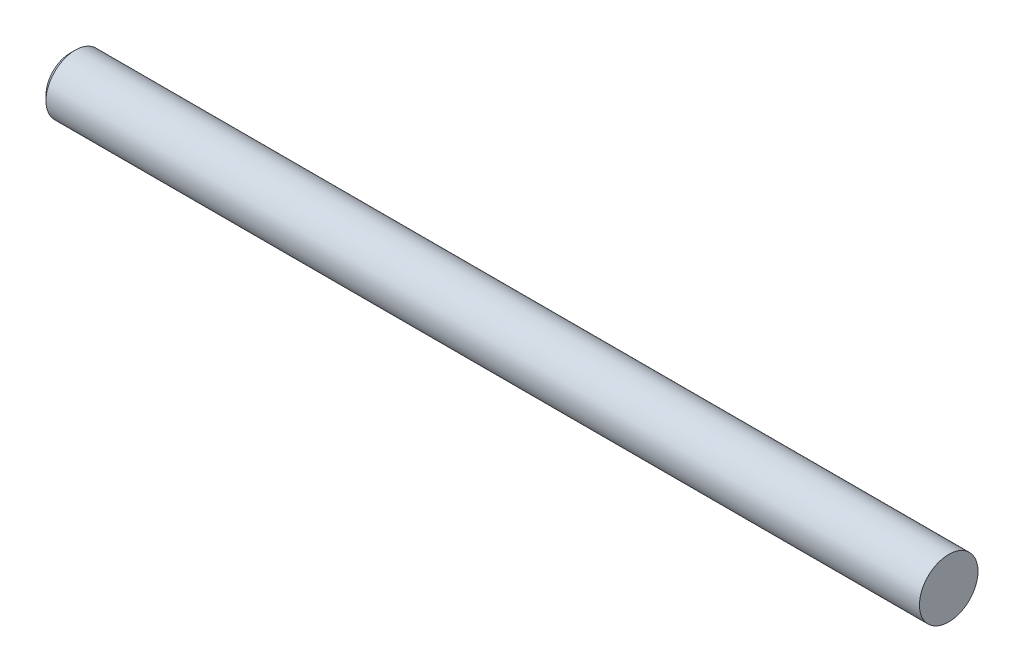
from build123d import *

# Parameters (mm, degrees)
SKETCH_1_R      = 4
EXTRUDE_1_DEPTH = 120


# Read off the part's stored shape, not the designer's step: M8 机械螺纹 螺柱1
with BuildPart() as part:
    # 草图1 → 凸台-拉伸1 (new body)
    with BuildSketch(Plane(origin=(0, 0, 0), x_dir=(0, 0, -1), z_dir=(1, 0, 0))):
        Circle(SKETCH_1_R)
    extrude(amount=EXTRUDE_1_DEPTH)

    # M8 机械螺纹 螺柱1 outline → M8 机械螺纹 螺柱1 (revolve, cut)
    with BuildSketch(Plane.YX):
        Polygon((4, 0.6765), (3.3235, 0), (4, 0), align=None)
    revolve(axis=Axis((0, 0, 0), (1, 0, 0)), mode=Mode.SUBTRACT)


solid = part.part
